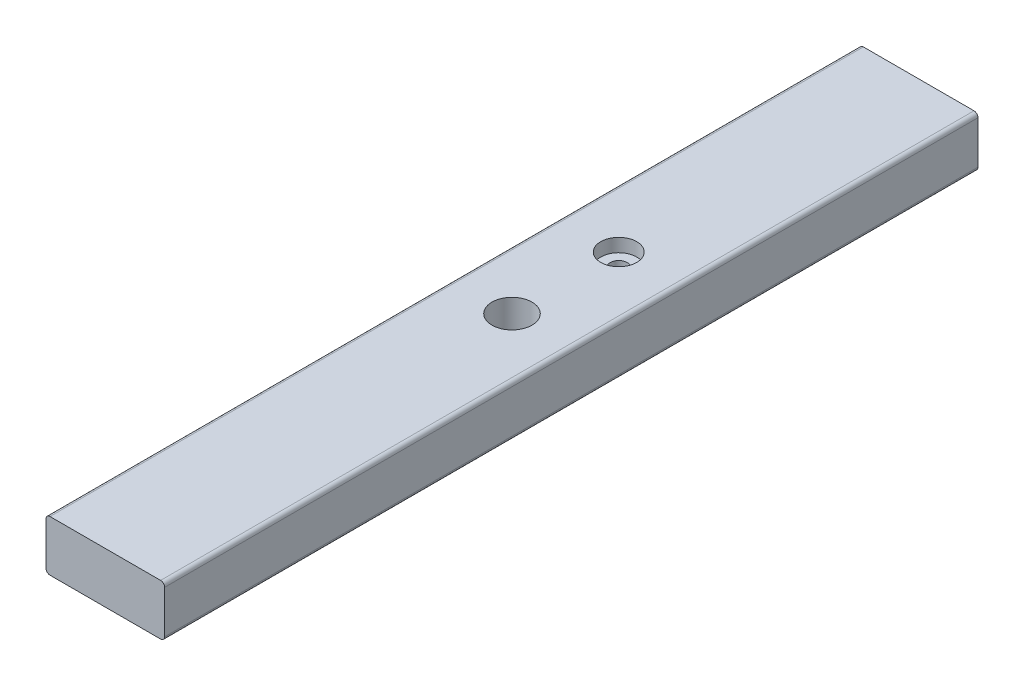
from build123d import *

# Parameters (mm, degrees)
BOSS_EXTRUDE1_DEPTH = 609.6
SKETCH2_R           = 15
SKETCH2_R_2         = 6.35
CUT_EXTRUDE1_DEPTH  = 613.404745654
SKETCH3_R           = 13.5001
CUT_EXTRUDE2_DEPTH  = 10


with BuildPart() as part:
    # Sketch1 → Boss-Extrude1 (new body)
    with BuildSketch(Plane.XY):
        with BuildLine():
            Line((41.45, -19.05), (-41.45, -19.05))
            ThreePointArc((-41.45, -19.05), (-43.571320344, -18.171320344), (-44.45, -16.05))
            Line((-44.45, -16.05), (-44.45, 16.05))
            ThreePointArc((-44.45, 16.05), (-43.571320344, 18.171320344), (-41.45, 19.05))
            Line((-41.45, 19.05), (41.45, 19.05))
            ThreePointArc((41.45, 19.05), (43.571320344, 18.171320344), (44.45, 16.05))
            Line((44.45, 16.05), (44.45, -16.05))
            ThreePointArc((44.45, -16.05), (43.571320344, -18.171320344), (41.45, -19.05))
        make_face()
    extrude(amount=BOSS_EXTRUDE1_DEPTH)

    # Sketch2 → Cut-Extrude1 (cut, through all)
    with BuildSketch(Plane(origin=(0, 19.05, 0), x_dir=(1, 0, 0), z_dir=(0, 1, 0))):
        with Locations((0, -304.8)):
            Circle(SKETCH2_R)
        with Locations((0, -224.8)):
            Circle(SKETCH2_R_2)
    extrude(amount=-CUT_EXTRUDE1_DEPTH, mode=Mode.SUBTRACT)

    # Sketch3 → Cut-Extrude2 (cut)
    with BuildSketch(Plane(origin=(0, 19.05, 0), x_dir=(1, 0, 0), z_dir=(0, 1, 0))):
        with Locations((0, -224.8)):
            Circle(SKETCH3_R)
    cut_extrude2 = extrude(amount=-CUT_EXTRUDE2_DEPTH, mode=Mode.SUBTRACT)

    # Mirror1: Cut-Extrude2 across plane
    add(cut_extrude2.mirror(Plane.ZX), mode=Mode.SUBTRACT)


solid = part.part
